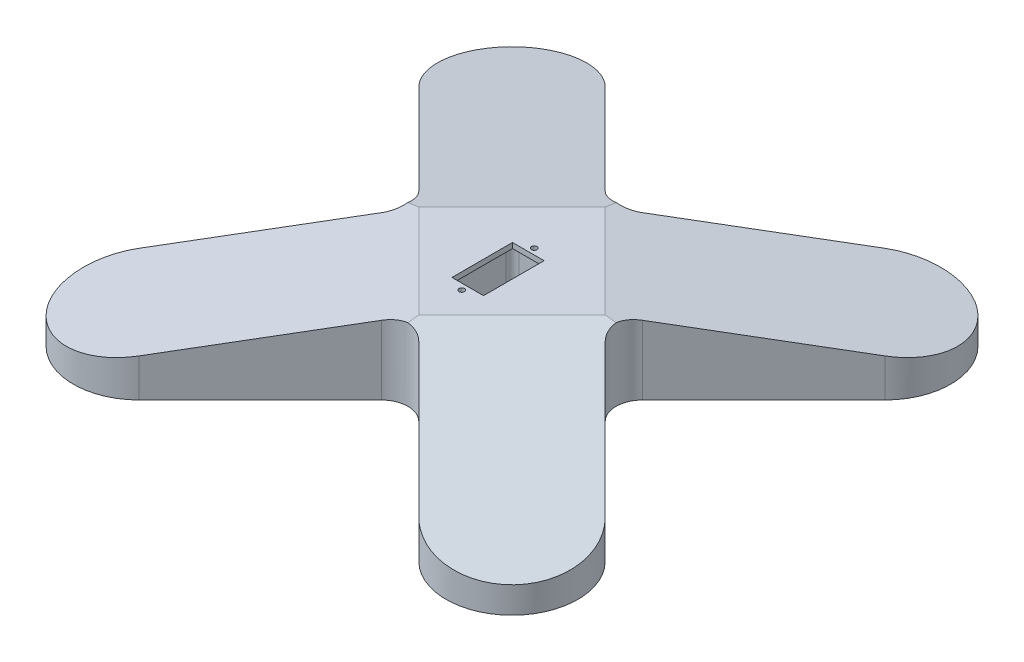
from build123d import *

# Parameters (mm, degrees)
BOSS_EXTRUDE2_DEPTH = 28
SKETCH3_R           = 1.05
SKETCH3_W           = 11.98
SKETCH3_H           = 22.98
CUT_EXTRUDE1_DEPTH  = 28
CUT_EXTRUDE2_START  = -25
SKETCH4_R           = 1.05
SKETCH4_W           = 11.98
SKETCH4_H           = 22.98
CUT_EXTRUDE2_DEPTH  = 25
CUT_EXTRUDE4_DEPTH  = 10
CUT_EXTRUDE5_REACH  = 164.782
CIRPATTERN1_COUNT   = 4
FILLET1_R           = 10
CHAMFER1_SIZE       = 1
FILLET2_R           = 2.5


with BuildPart() as part:
    # Sketch1 → Boss-Extrude2 (new body)
    with BuildSketch(Plane(origin=(0, 0, 0), x_dir=(1, 0, 0), z_dir=(0, 1, 0))):
        with BuildLine():
            Line((0, 35.355339059), (53.033008589, 88.388347648))
            ThreePointArc((53.033008589, 88.388347648), (88.388347648, 88.388347648), (88.388347648, 53.033008589))
            Line((88.388347648, 53.033008589), (35.355339059, 0))
            Line((35.355339059, 0), (88.388347648, -53.033008589))
            ThreePointArc((88.388347648, -53.033008589), (88.388347648, -88.388347648), (53.033008589, -88.388347648))
            Line((53.033008589, -88.388347648), (0, -35.355339059))
            Line((0, -35.355339059), (-53.033008589, -88.388347648))
            ThreePointArc((-53.033008589, -88.388347648), (-88.388347648, -88.388347648), (-88.388347648, -53.033008589))
            Line((-88.388347648, -53.033008589), (-35.355339059, 0))
            Line((-35.355339059, 0), (-88.388347648, 53.033008589))
            ThreePointArc((-88.388347648, 53.033008589), (-88.388347648, 88.388347648), (-53.033008589, 88.388347648))
            Line((-53.033008589, 88.388347648), (0, 35.355339059))
        make_face()
    extrude(amount=BOSS_EXTRUDE2_DEPTH)

    # Sketch3 → Cut-Extrude1 (cut)
    with BuildSketch(Plane(origin=(0, 28, 0), x_dir=(1, 0, 0), z_dir=(0, 1, 0))):
        with Locations(Location((0, 8.47, 0), (0, 0, 270))):
            Circle(SKETCH3_R)
        with Locations(Location((0, -19.09, 0), (0, 0, 90))):
            Circle(SKETCH3_R)
        with Locations((0, -5.31)):
            Rectangle(SKETCH3_W, SKETCH3_H)
    extrude(amount=-CUT_EXTRUDE1_DEPTH, mode=Mode.SUBTRACT)

    # Sketch4 → Cut-Extrude2 (cut)
    with BuildSketch(Plane.XZ.offset(CUT_EXTRUDE2_START)):
        Polygon((15.99, -16.18), (15.99, 26.8), (7.5, 26.8), (-7.5, 26.8), (-15.99, 26.8), (-15.99, -16.18), (-7.5, -16.18), (7.5, -16.18), align=None)
        with Locations(Location((0, -8.47, 0), (0, 0, 90))):
            Circle(SKETCH4_R, mode=Mode.SUBTRACT)
        with Locations(Location((0, 19.09, 0), (0, 0, 270))):
            Circle(SKETCH4_R, mode=Mode.SUBTRACT)
        with Locations((0, 5.31)):
            Rectangle(SKETCH4_W, SKETCH4_H, mode=Mode.SUBTRACT)
    extrude(amount=CUT_EXTRUDE2_DEPTH, mode=Mode.SUBTRACT)

    # Sketch4<4> → Cut-Extrude4 (cut)
    with BuildSketch(Plane.XZ):
        Polygon((-7.5, -16.18), (-7.5, -42.855339059), (0, -35.355339059), (7.5, -42.855339059), (7.5, -16.18), align=None)
    extrude(amount=-CUT_EXTRUDE4_DEPTH, mode=Mode.SUBTRACT)

    # Sketch5 → Cut-Extrude5 (cut, up to next)
    with BuildSketch(Plane(origin=(17.67766953, 0, -17.67766953), x_dir=(-0.7071067811865419, 0, -0.7071067811865532), z_dir=(0.7071067811865532, 0, -0.7071067811865419)), mode=Mode.PRIVATE) as cut_extrude5_sk1:
        Polygon((-25, 28), (-125, 10), (-125, 28), align=None)
    cut_extrude5_tool1 = extrude(cut_extrude5_sk1.sketch, amount=-CUT_EXTRUDE5_REACH, mode=Mode.PRIVATE) & part.part
    cut_extrude5 = cut_extrude5_tool1.solids().sort_by_distance((82.495791, 22, 47.140452))[0]
    add(cut_extrude5, mode=Mode.SUBTRACT)

    # CirPattern1: Cut-Extrude5 ×4 about axis
    cirpattern1_axis = Axis((0, 0, 0), (0, 1, 0))
    for i in range(1, CIRPATTERN1_COUNT):
        add(cut_extrude5.rotate(cirpattern1_axis, i * 360 / CIRPATTERN1_COUNT), mode=Mode.SUBTRACT)

    # Fillet1
    # the kernel refuses this fillet: 10 mm, written as the material it adds along each edge
    with BuildSketch(Plane(origin=(0, 10, -35.355339059), x_dir=(-0.7071067811865379, 0, -0.7071067811865571), z_dir=(0, 1, 0))) as fillet1_piece_1_section:
        with BuildLine():
            CenterArc((FILLET1_R, -FILLET1_R), FILLET1_R, 90, 90)
            Line((0, -FILLET1_R), (0, 0))
            Line((0, 0), (FILLET1_R, 0))
        make_face()
    fillet1_piece_1 = extrude(amount=43, mode=Mode.PRIVATE)
    fillet1_piece_1 = split(fillet1_piece_1, bisect_by=Plane(origin=(-1.101274735, 27.315624415, -39.63102674), z_dir=(0.12526608641625125, -0.9841833239736955, 0.1252660864162533)), keep=Keep.TOP, mode=Mode.PRIVATE)
    fillet1_piece_1 = split(fillet1_piece_1, bisect_by=Plane(origin=(1.101274735, 27.315624415, -39.63102674), z_dir=(-0.1252660864162533, -0.9841833239736955, 0.12526608641625125)), keep=Keep.TOP, mode=Mode.PRIVATE)
    add(fillet1_piece_1)
    with BuildSketch(Plane(origin=(35.355339059, 0, 0), x_dir=(0.7071067811865419, 0, 0.7071067811865532), z_dir=(0, 1, 0))) as fillet1_piece_2_section:
        with BuildLine():
            CenterArc((FILLET1_R, FILLET1_R), FILLET1_R, 180, 90)
            Line((0, FILLET1_R), (0, 0))
            Line((0, 0), (FILLET1_R, 0))
        make_face()
    fillet1_piece_2 = extrude(amount=53, mode=Mode.PRIVATE)
    fillet1_piece_2 = split(fillet1_piece_2, bisect_by=Plane(origin=(40.257461149, 27.157432054, 1.717716892), z_dir=(-0.12526608641625128, -0.9841833239736955, -0.12526608641625328)), keep=Keep.TOP, mode=Mode.PRIVATE)
    fillet1_piece_2 = split(fillet1_piece_2, bisect_by=Plane(origin=(40.257461149, 27.157432054, -1.717716892), z_dir=(-0.1252660864162533, -0.9841833239736955, 0.12526608641625125)), keep=Keep.TOP, mode=Mode.PRIVATE)
    add(fillet1_piece_2)
    with BuildSketch(Plane(origin=(0, 0, 35.355339059), x_dir=(-0.7071067811865579, 0, 0.7071067811865371), z_dir=(0, 1, 0))) as fillet1_piece_3_section:
        with BuildLine():
            CenterArc((FILLET1_R, FILLET1_R), FILLET1_R, 180, 90)
            Line((0, FILLET1_R), (0, 0))
            Line((0, 0), (FILLET1_R, 0))
        make_face()
    fillet1_piece_3 = extrude(amount=53, mode=Mode.PRIVATE)
    fillet1_piece_3 = split(fillet1_piece_3, bisect_by=Plane(origin=(-1.717716892, 27.157432054, 40.257461149), z_dir=(0.1252660864162533, -0.9841833239736955, -0.12526608641625125)), keep=Keep.TOP, mode=Mode.PRIVATE)
    fillet1_piece_3 = split(fillet1_piece_3, bisect_by=Plane(origin=(1.717716892, 27.157432054, 40.257461149), z_dir=(-0.12526608641625128, -0.9841833239736955, -0.12526608641625328)), keep=Keep.TOP, mode=Mode.PRIVATE)
    add(fillet1_piece_3)
    with BuildSketch(Plane(origin=(-35.355339059, 0, 0), x_dir=(-0.7071067811865355, 0, -0.7071067811865597), z_dir=(0, 1, 0))) as fillet1_piece_4_section:
        with BuildLine():
            CenterArc((FILLET1_R, FILLET1_R), FILLET1_R, 180, 90)
            Line((0, FILLET1_R), (0, 0))
            Line((0, 0), (FILLET1_R, 0))
        make_face()
    fillet1_piece_4 = extrude(amount=53, mode=Mode.PRIVATE)
    fillet1_piece_4 = split(fillet1_piece_4, bisect_by=Plane(origin=(-40.257461149, 27.157432054, -1.717716892), z_dir=(0.12526608641625125, -0.9841833239736955, 0.1252660864162533)), keep=Keep.TOP, mode=Mode.PRIVATE)
    fillet1_piece_4 = split(fillet1_piece_4, bisect_by=Plane(origin=(-40.257461149, 27.157432054, 1.717716892), z_dir=(0.1252660864162533, -0.9841833239736955, -0.12526608641625125)), keep=Keep.TOP, mode=Mode.PRIVATE)
    add(fillet1_piece_4)

    # Chamfer1
    # the kernel refuses this chamfer: 1 mm, written as the material it adds along each edge
    with BuildSketch(Plane(origin=(15.99, 25, -18.751682988), x_dir=(0.027495876610585647, -0.9996219169112968, 0), z_dir=(0, 0, 1)), Plane(origin=(-15.99, 25, 29.371682988), x_dir=(-0.027495876610585647, -0.9996219169112968, 0), z_dir=(0, 0, -1))) as chamfer1_piece_1:
        Polygon((CHAMFER1_SIZE * 0.999621916911, -CHAMFER1_SIZE * 0.0274958766106), (-CHAMFER1_SIZE * 0.0274958766106, -CHAMFER1_SIZE * 0.999621916911), (0, 0), align=None)
    extrude(amount=48.123365976)
    with BuildSketch(Plane(origin=(-18.561682988, 25, -16.18), x_dir=(0, -0.9996219169112968, -0.027495876610585647), z_dir=(1, 0, 0)), Plane(origin=(18.561682988, 25, 26.8), x_dir=(0, -0.9996219169112968, 0.027495876610585647), z_dir=(-1, 0, 0))) as chamfer1_piece_2:
        Polygon((CHAMFER1_SIZE * 0.999621916911, -CHAMFER1_SIZE * 0.0274958766106), (-CHAMFER1_SIZE * 0.0274958766106, -CHAMFER1_SIZE * 0.999621916911), (0, 0), align=None)
    extrude(amount=37.123365976)
    # the kernel refuses this chamfer: 1 mm, written as the material it takes off along each edge
    with BuildSketch(Plane(origin=(-5.99, 25, 16.8), x_dir=(0, 0.9996219169112968, -0.027495876610585647), z_dir=(1, 0, 0)), Plane(origin=(5.99, 25, -6.18), x_dir=(0, 0.9996219169112968, 0.02749587661058651), z_dir=(-1, 0, 0))) as chamfer1_2_piece_1:
        Polygon((CHAMFER1_SIZE * 0.999621916911, CHAMFER1_SIZE * 0.0274958766106), (-CHAMFER1_SIZE * 0.0274958766106, CHAMFER1_SIZE * 0.999621916911), (0, 0), align=None)
    extrude(amount=11.98, mode=Mode.SUBTRACT)
    with BuildSketch(Plane(origin=(-5.99, 25, -6.18), x_dir=(0.02749587661057961, 0.999621916911297, 0), z_dir=(0, 0, 1)), Plane(origin=(5.99, 25, 16.8), x_dir=(-0.02749587661058651, 0.9996219169112968, 0), z_dir=(0, 0, -1))) as chamfer1_2_piece_2:
        Polygon((CHAMFER1_SIZE * 0.999621916911, CHAMFER1_SIZE * 0.0274958766106), (-CHAMFER1_SIZE * 0.0274958766106, CHAMFER1_SIZE * 0.999621916911), (0, 0), align=None)
    extrude(amount=22.98, mode=Mode.SUBTRACT)
    with BuildSketch(Plane(origin=(0, 25, 19.09), x_dir=(0, 0, -1), z_dir=(-1, 0, 0))) as chamfer1_2_piece_3:
        Polygon((1.05, -CHAMFER1_SIZE), (1.05 + CHAMFER1_SIZE, 0), (1.05, 0), align=None)
    revolve(axis=Axis((0, 25, 19.09), (0, -1, 0)), mode=Mode.SUBTRACT)
    with BuildSketch(Plane(origin=(0, 25, -8.47), x_dir=(0, 0, 1), z_dir=(1, 0, 0))) as chamfer1_2_piece_4:
        Polygon((1.05, -CHAMFER1_SIZE), (1.05 + CHAMFER1_SIZE, 0), (1.05, 0), align=None)
    revolve(axis=Axis((0, 25, -8.47), (0, -1, 0)), mode=Mode.SUBTRACT)
    with BuildSketch(Plane(origin=(-5.99, 25, -6.18), x_dir=(0.02749587661057961, 0.999621916911297, 0), z_dir=(0, 0, 1))) as chamfer1_2_piece_5a_section:
        Polygon((CHAMFER1_SIZE * 0.999621916911, CHAMFER1_SIZE * 0.0274958766106), (-CHAMFER1_SIZE * 0.0274958766106, CHAMFER1_SIZE * 0.999621916911), (0, 0), align=None)
    chamfer1_2_piece_5a = extrude(amount=25.551682988, mode=Mode.PRIVATE)
    chamfer1_2_piece_5a = split(chamfer1_2_piece_5a, bisect_by=Plane(origin=(-6.319793627, 25.329793627, 16.8), z_dir=(0, 0, 1)), keep=Keep.TOP, mode=Mode.PRIVATE)
    with BuildSketch(Plane(origin=(-8.561682988, 25, 16.8), x_dir=(0, 0.9996219169112968, -0.027495876610585647), z_dir=(1, 0, 0))) as chamfer1_2_piece_5b_section:
        Polygon((CHAMFER1_SIZE * 0.999621916911, CHAMFER1_SIZE * 0.0274958766106), (-CHAMFER1_SIZE * 0.0274958766106, CHAMFER1_SIZE * 0.999621916911), (0, 0), align=None)
    chamfer1_2_piece_5b = extrude(amount=14.551682988, mode=Mode.PRIVATE)
    chamfer1_2_piece_5b = split(chamfer1_2_piece_5b, bisect_by=Plane(origin=(-5.99, 25.329793627, 17.129793627), z_dir=(-1, 0, 0)), keep=Keep.TOP, mode=Mode.PRIVATE)
    chamfer1_2_piece_5 = chamfer1_2_piece_5a & chamfer1_2_piece_5b
    add(chamfer1_2_piece_5, mode=Mode.SUBTRACT)
    with BuildSketch(Plane(origin=(-5.99, 25, 16.8), x_dir=(0, 0.9996219169112968, -0.027495876610585647), z_dir=(1, 0, 0))) as chamfer1_2_piece_6a_section:
        Polygon((CHAMFER1_SIZE * 0.999621916911, CHAMFER1_SIZE * 0.0274958766106), (-CHAMFER1_SIZE * 0.0274958766106, CHAMFER1_SIZE * 0.999621916911), (0, 0), align=None)
    chamfer1_2_piece_6a = extrude(amount=14.551682988, mode=Mode.PRIVATE)
    chamfer1_2_piece_6a = split(chamfer1_2_piece_6a, bisect_by=Plane(origin=(5.99, 25.329793627, 17.129793627), z_dir=(1, 0, 0)), keep=Keep.TOP, mode=Mode.PRIVATE)
    with BuildSketch(Plane(origin=(5.99, 25, 19.371682988), x_dir=(-0.02749587661058651, 0.9996219169112968, 0), z_dir=(0, 0, -1))) as chamfer1_2_piece_6b_section:
        Polygon((CHAMFER1_SIZE * 0.999621916911, CHAMFER1_SIZE * 0.0274958766106), (-CHAMFER1_SIZE * 0.0274958766106, CHAMFER1_SIZE * 0.999621916911), (0, 0), align=None)
    chamfer1_2_piece_6b = extrude(amount=25.551682988, mode=Mode.PRIVATE)
    chamfer1_2_piece_6b = split(chamfer1_2_piece_6b, bisect_by=Plane(origin=(6.319793627, 25.329793627, 16.8), z_dir=(0, 0, 1)), keep=Keep.TOP, mode=Mode.PRIVATE)
    chamfer1_2_piece_6 = chamfer1_2_piece_6a & chamfer1_2_piece_6b
    add(chamfer1_2_piece_6, mode=Mode.SUBTRACT)
    with BuildSketch(Plane(origin=(-5.99, 25, -8.751682988), x_dir=(0.02749587661058651, 0.9996219169112968, 0), z_dir=(0, 0, 1))) as chamfer1_2_piece_7a_section:
        Polygon((CHAMFER1_SIZE * 0.999621916911, CHAMFER1_SIZE * 0.0274958766106), (-CHAMFER1_SIZE * 0.0274958766106, CHAMFER1_SIZE * 0.999621916911), (0, 0), align=None)
    chamfer1_2_piece_7a = extrude(amount=25.551682988, mode=Mode.PRIVATE)
    chamfer1_2_piece_7a = split(chamfer1_2_piece_7a, bisect_by=Plane(origin=(-6.319793627, 25.329793627, -6.18), z_dir=(0, 0, -1)), keep=Keep.TOP, mode=Mode.PRIVATE)
    with BuildSketch(Plane(origin=(5.99, 25, -6.18), x_dir=(0, 0.9996219169112968, 0.02749587661058651), z_dir=(-1, 0, 0))) as chamfer1_2_piece_7b_section:
        Polygon((CHAMFER1_SIZE * 0.999621916911, CHAMFER1_SIZE * 0.0274958766106), (-CHAMFER1_SIZE * 0.0274958766106, CHAMFER1_SIZE * 0.999621916911), (0, 0), align=None)
    chamfer1_2_piece_7b = extrude(amount=14.551682988, mode=Mode.PRIVATE)
    chamfer1_2_piece_7b = split(chamfer1_2_piece_7b, bisect_by=Plane(origin=(-5.99, 25.329793627, -6.509793627), z_dir=(-1, 0, 0)), keep=Keep.TOP, mode=Mode.PRIVATE)
    chamfer1_2_piece_7 = chamfer1_2_piece_7a & chamfer1_2_piece_7b
    add(chamfer1_2_piece_7, mode=Mode.SUBTRACT)
    with BuildSketch(Plane(origin=(8.561682988, 25, -6.18), x_dir=(0, 0.9996219169112968, 0.02749587661058651), z_dir=(-1, 0, 0))) as chamfer1_2_piece_8a_section:
        Polygon((CHAMFER1_SIZE * 0.999621916911, CHAMFER1_SIZE * 0.0274958766106), (-CHAMFER1_SIZE * 0.0274958766106, CHAMFER1_SIZE * 0.999621916911), (0, 0), align=None)
    chamfer1_2_piece_8a = extrude(amount=14.551682988, mode=Mode.PRIVATE)
    chamfer1_2_piece_8a = split(chamfer1_2_piece_8a, bisect_by=Plane(origin=(5.99, 25.329793627, -6.509793627), z_dir=(1, 0, 0)), keep=Keep.TOP, mode=Mode.PRIVATE)
    with BuildSketch(Plane(origin=(5.99, 25, 16.8), x_dir=(-0.02749587661058651, 0.9996219169112968, 0), z_dir=(0, 0, -1))) as chamfer1_2_piece_8b_section:
        Polygon((CHAMFER1_SIZE * 0.999621916911, CHAMFER1_SIZE * 0.0274958766106), (-CHAMFER1_SIZE * 0.0274958766106, CHAMFER1_SIZE * 0.999621916911), (0, 0), align=None)
    chamfer1_2_piece_8b = extrude(amount=25.551682988, mode=Mode.PRIVATE)
    chamfer1_2_piece_8b = split(chamfer1_2_piece_8b, bisect_by=Plane(origin=(6.319793627, 25.329793627, -6.18), z_dir=(0, 0, -1)), keep=Keep.TOP, mode=Mode.PRIVATE)
    chamfer1_2_piece_8 = chamfer1_2_piece_8a & chamfer1_2_piece_8b
    add(chamfer1_2_piece_8, mode=Mode.SUBTRACT)

    # Fillet2
    fillet2_edges = [part.edges().sort_by_distance(p)[0] for p in [
        (7.5, 5, -16.18),
        (7.5, 5, -42.855339059),
        (-7.5, 5, -42.855339059),
        (-7.5, 5, -16.18),
        (15.99, 12, -16.18),
        (-15.99, 12, -16.18),
        (-15.99, 12, 26.8),
        (15.99, 12, 26.8),
    ]]
    fillet(fillet2_edges, radius=FILLET2_R)


solid = part.part
